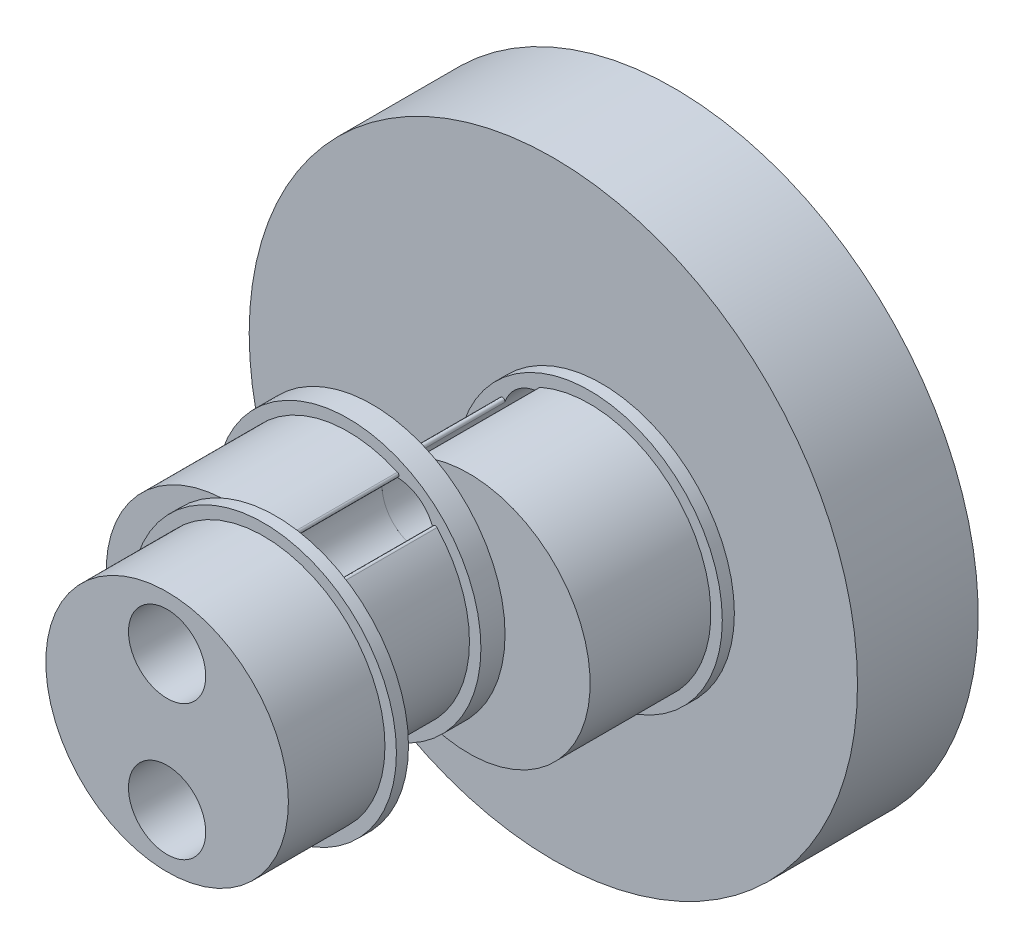
from build123d import *

# Parameters (mm, degrees)
SKETCH1_R            = 12.6
BOSS_EXTRUDE1_DEPTH  = 5
SKETCH2_R            = 5.499454457575955
SKETCH2_R_2          = 5.0249999999999995
BOSS_EXTRUDE2_DEPTH  = 0.5
SKETCH2_3_R          = 5.0249999999999995
BOSS_EXTRUDE3_DEPTH  = 5.5
BOSS_EXTRUDE4_START  = 5.5
SKETCH3_R            = 5.5
SKETCH3_R_2          = 5.0249999999999995
BOSS_EXTRUDE4_DEPTH  = 1
BOSS_EXTRUDE5_START  = 5.5
SKETCH3_3_R          = 5.0249999999999995
BOSS_EXTRUDE5_DEPTH  = 6
BOSS_EXTRUDE6_START  = 11.5
SKETCH4_R            = 5.5
SKETCH4_R_2          = 5.0249999999999995
BOSS_EXTRUDE6_DEPTH  = 0.5
BOSS_EXTRUDE7_START  = 11.5
SKETCH4_7_R          = 5.0249999999999995
BOSS_EXTRUDE7_DEPTH  = 4.5
SKETCH5_R            = 1.6000000000000003
CUT_EXTRUDE1_DEPTH   = 28.541241802068402
SPLIT1_START         = 8.5
SPLIT1_OUTLINE_R     = 1.6
SPLIT1_DEPTH         = 10.5
SPLIT1_2_DEPTH       = 6
SPLIT1_3_OUTLINE_R   = 5.5
SPLIT1_3_DEPTH       = 1
SPLIT1_START_2       = 14.5
SPLIT1_4_OUTLINE_R   = 5.025
SPLIT1_4_OUTLINE_R_2 = 1.6
SPLIT1_4_DEPTH       = 4.5
SPLIT1_5_OUTLINE_R   = 5.5
SPLIT1_5_OUTLINE_R_2 = 5.025
SPLIT1_5_DEPTH       = 0.5
FILLET1_R            = 0.1
FILLET2_R            = 0.1


# Read off the part's stored shape, not the designer's step: Split1
with BuildPart() as part:
    # Sketch1 → Boss-Extrude1 (new body)
    with BuildSketch(Plane(origin=(0, 0, -2), x_dir=(-1, 0, 0), z_dir=(0, 0, -1))):
        Circle(SKETCH1_R)
    extrude(amount=-BOSS_EXTRUDE1_DEPTH)

    # Sketch2 → Boss-Extrude2 (add)
    with BuildSketch(Plane.XY.offset(3)):
        with Locations((2, 0)):
            Circle(SKETCH2_R)
        with Locations((2, 0)):
            Circle(SKETCH2_R_2, mode=Mode.SUBTRACT)
    extrude(amount=BOSS_EXTRUDE2_DEPTH)

    # Sketch2<3> → Boss-Extrude3 (add)
    with BuildSketch(Plane.XY.offset(3)):
        with Locations((2, 0)):
            Circle(SKETCH2_3_R)
    extrude(amount=BOSS_EXTRUDE3_DEPTH)



with BuildPart() as body_2:
    # Sketch3 → Boss-Extrude4 (new body)
    with BuildSketch(Plane.XY.offset(3).offset(BOSS_EXTRUDE4_START)):
        with Locations((-2, -2.4e-16)):
            Circle(SKETCH3_R)
        with Locations((-2, -2.4e-16)):
            Circle(SKETCH3_R_2, mode=Mode.SUBTRACT)
    extrude(amount=BOSS_EXTRUDE4_DEPTH)


with BuildPart() as part_1:
    add(part.part)

    add(body_2.part)  # Boss-Extrude5 merges body 2
    # Sketch3<3> → Boss-Extrude5 (add)
    with BuildSketch(Plane.XY.offset(3).offset(BOSS_EXTRUDE5_START)):
        with Locations((-2, -2.4e-16)):
            Circle(SKETCH3_3_R)
    extrude(amount=BOSS_EXTRUDE5_DEPTH)

    # Sketch4 → Boss-Extrude6 (add)
    with BuildSketch(Plane.XY.offset(3).offset(BOSS_EXTRUDE6_START)):
        with Locations(Location((0, 0, 0), (0, 0, 114.145956113))):
            Circle(SKETCH4_R)
        with Locations(Location((0, 0, 0), (0, 0, 101.478778724))):
            Circle(SKETCH4_R_2, mode=Mode.SUBTRACT)
    extrude(amount=BOSS_EXTRUDE6_DEPTH)

    # Sketch4<7> → Boss-Extrude7 (add)
    with BuildSketch(Plane.XY.offset(3).offset(BOSS_EXTRUDE7_START)):
        Circle(SKETCH4_7_R)
    extrude(amount=BOSS_EXTRUDE7_DEPTH)

    # Sketch5 → Cut-Extrude1 (cut, through all)
    with BuildSketch(Plane.XY.offset(19)):
        with Locations((2e-17, 2.8)):
            Circle(SKETCH5_R)
        with Locations((7.1e-16, -2.8)):
            Circle(SKETCH5_R)
    extrude(amount=-CUT_EXTRUDE1_DEPTH, mode=Mode.SUBTRACT)

    # Split1 outline → Split1 (cut)
    with BuildSketch(Plane.XY.offset(SPLIT1_START)):
        with BuildLine():
            ThreePointArc((-1, 5.408326913), (-7.5, 0), (-1, -5.408326913))
            ThreePointArc((-1, -5.408326913), (5.5, 0), (-1, 5.408326913))
        make_face()
        with Locations((0, 2.8)):
            Circle(SPLIT1_OUTLINE_R, mode=Mode.SUBTRACT)
        with Locations((0, -2.8)):
            Circle(SPLIT1_OUTLINE_R, mode=Mode.SUBTRACT)
    extrude(amount=SPLIT1_DEPTH, mode=Mode.SUBTRACT)

    # Fillet2
    fillet2_edges = [part_1.edges().sort_by_distance(p)[0] for p in [
        (-0.6950501563684846, -4.241147209736796, 6),
        (-1.1378256882261084, -3.9248789726956352, 6),
        (-1.1378256882260929, 3.924878972695648, 6),
        (-0.6950501563685023, 4.241147209736784, 6),
    ]]
    fillet(fillet2_edges, radius=FILLET2_R)


with BuildPart() as body_2_2:
    # Split1 2 outline → Split1 2 (new body)
    with BuildSketch(Plane.XY.offset(SPLIT1_START)):
        with BuildLine():
            ThreePointArc((1.137825688, -3.924878973), (3.025, 0), (1.137825688, 3.924878973))
            ThreePointArc((1.137825688, 3.924878973), (-0.92998111, 1.498026446), (0.695050156, 4.24114721))
            ThreePointArc((0.695050156, 4.24114721), (-7.025, 0), (0.695050156, -4.24114721))
            ThreePointArc((0.695050156, -4.24114721), (-0.92998111, -1.498026446), (1.137825688, -3.924878973))
        make_face()
    extrude(amount=SPLIT1_2_DEPTH)

    # Split1 3 outline → Split1 3 (add)
    with BuildSketch(Plane.XY.offset(SPLIT1_START)):
        with Locations((-2, 0)):
            Circle(SPLIT1_3_OUTLINE_R)
        with BuildLine():
            ThreePointArc((0.695050156, 4.24114721), (0.92998111, 4.101973554), (1.137825688, 3.924878973))
            ThreePointArc((1.137825688, 3.924878973), (3.025, 0), (1.137825688, -3.924878973))
            ThreePointArc((1.137825688, -3.924878973), (0.92998111, -4.101973554), (0.695050156, -4.24114721))
            ThreePointArc((0.695050156, -4.24114721), (-7.025, 0), (0.695050156, 4.24114721))
        make_face(mode=Mode.SUBTRACT)
    extrude(amount=SPLIT1_3_DEPTH)

    # Fillet1
    # the kernel refuses this fillet: 0.1 mm, written as the material it takes off along each edge
    with BuildSketch(Plane(origin=(1.1378256880000006, -3.924878973, 9.5), x_dir=(0.5272838464707954, 0.8496892050926401, 0), z_dir=(0, 0, 1))) as fillet1_piece_1:
        with BuildLine():
            CenterArc((0.7339208558356513, -0.09749554475196075), FILLET1_R, 102.8500510005881, 156.06997269077794)
            ThreePointArc((0.7147029545095785, -0.19563153340353207), (0.3537405486988825, -0.1110076139593656), (0, 0))
            ThreePointArc((0, 0), (0.3558404149511242, -0.0400712839705069), (0.7116808299022489, -4e-17))
        make_face()
    extrude(amount=6.85248483469929, mode=Mode.SUBTRACT)
    with BuildSketch(Plane(origin=(0.6950501559999995, -4.241147210000001, 9.5), x_dir=(-0.9747710361649122, -0.22320713934366773, 0), z_dir=(0, 0, 1))) as fillet1_piece_2:
        with BuildLine():
            CenterArc((0.7339208553218103, 0.09749554475551281), FILLET1_R, 101.07997632228573, 156.06997268627677)
            ThreePointArc((0.714702953972355, 0.19563153340250483), (0.35374054843265157, 0.1110076139403167), (0, 0))
            ThreePointArc((0, 0), (0.35584041470198946, 0.04007128391367626), (0.7116808294039787, 0))
        make_face()
    extrude(amount=6.8524848334032065, mode=Mode.SUBTRACT)
    with BuildSketch(Plane(origin=(0.6950501560000002, 4.24114721, 9.5), x_dir=(-0.8812560463152725, 0.4726391655721877, 0), z_dir=(0, 0, 1))) as fillet1_piece_3:
        with BuildLine():
            CenterArc((0.7336208593975166, 0.09972781848774585), FILLET1_R, 118.15832442623193, 156.06997268627686)
            ThreePointArc((0.6864298993019216, 0.18789251258496353), (0.353794262604145, 0.05529672936227222), (0, 0))
            ThreePointArc((0, 0), (0.3704969666806427, -0.01367712099081776), (0.7409939333612872, 0))
        make_face()
    extrude(amount=6.852484833403217, mode=Mode.SUBTRACT)
    with BuildSketch(Plane(origin=(1.1378256880000008, 3.924878973, 9.5), x_dir=(0.7329038743989365, -0.6803322062720741, 0), z_dir=(0, 0, 1))) as fillet1_piece_4:
        with BuildLine():
            CenterArc((0.7336208599111411, -0.09972781848739057), FILLET1_R, 85.77170288473079, 156.06997269077783)
            ThreePointArc((0.6864298998182243, -0.1878925125860417), (0.3537942628699536, -0.05529672930598591), (0, 0))
            ThreePointArc((0, 0), (0.3704969669398583, 0.013677121009324), (0.7409939338797163, 3e-17))
        make_face()
    extrude(amount=6.85248483469929, mode=Mode.SUBTRACT)


with BuildPart() as body_3:
    # Split1 4 outline → Split1 4 (new body)
    with BuildSketch(Plane.XY.offset(SPLIT1_START_2)):
        Circle(SPLIT1_4_OUTLINE_R)
        with Locations((0, -2.8)):
            Circle(SPLIT1_4_OUTLINE_R_2, mode=Mode.SUBTRACT)
        with Locations((0, 2.8)):
            Circle(SPLIT1_4_OUTLINE_R_2, mode=Mode.SUBTRACT)
    extrude(amount=SPLIT1_4_DEPTH)

    # Split1 5 outline → Split1 5 (add)
    with BuildSketch(Plane.XY.offset(SPLIT1_START_2)):
        Circle(SPLIT1_5_OUTLINE_R)
        Circle(SPLIT1_5_OUTLINE_R_2, mode=Mode.SUBTRACT)
    extrude(amount=SPLIT1_5_DEPTH)


solid = Compound([part_1.part, body_2_2.part, body_3.part])
